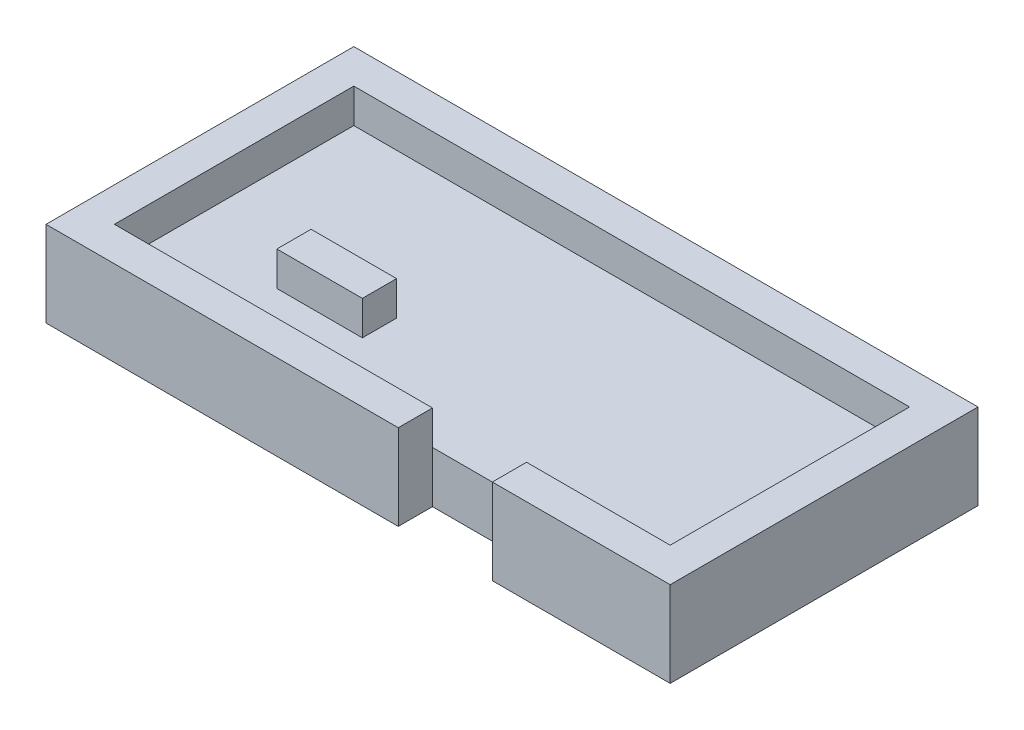
from build123d import *

# Parameters (mm, degrees)
SKETCH1_W           = 36.5
SKETCH1_H           = 18
BOSS_EXTRUDE1_DEPTH = 5
SKETCH2_W           = 32.5
SKETCH2_H           = 14
CUT_EXTRUDE1_DEPTH  = 2
SKETCH3_W           = 5
SKETCH3_H           = 2
BOSS_EXTRUDE2_DEPTH = 2
CUT_EXTRUDE2_REACH  = 42.165
SKETCH4_W           = 5.5
SKETCH4_H           = 5


with BuildPart() as part:
    # Sketch1 → Boss-Extrude1 (new body)
    with BuildSketch(Plane(origin=(0, 0, 0), x_dir=(1, 0, 0), z_dir=(0, 1, 0))):
        with Locations((18.25, 9)):
            Rectangle(SKETCH1_W, SKETCH1_H)
    extrude(amount=-BOSS_EXTRUDE1_DEPTH)

    # Sketch2 → Cut-Extrude1 (cut)
    with BuildSketch(Plane(origin=(0, 0, 0), x_dir=(1, 0, 0), z_dir=(0, 1, 0))):
        with Locations((18.25, 9)):
            Rectangle(SKETCH2_W, SKETCH2_H)
    extrude(amount=-CUT_EXTRUDE1_DEPTH, mode=Mode.SUBTRACT)

    # Sketch3 → Boss-Extrude2 (add)
    with BuildSketch(Plane(origin=(0, -2, 0), x_dir=(1, 0, 0), z_dir=(0, 1, 0))):
        with Locations((10.5, 6.5)):
            Rectangle(SKETCH3_W, SKETCH3_H)
    extrude(amount=BOSS_EXTRUDE2_DEPTH)

    # Sketch4 → Cut-Extrude2 (cut, up to next)
    with BuildSketch(Plane(origin=(0, 0, -2), x_dir=(-1, 0, 0), z_dir=(0, 0, -1)), mode=Mode.PRIVATE) as cut_extrude2_sk1:
        with Locations((-23.35, -2.5)):
            Rectangle(SKETCH4_W, SKETCH4_H)
    cut_extrude2_tool1 = extrude(cut_extrude2_sk1.sketch, amount=-CUT_EXTRUDE2_REACH, mode=Mode.PRIVATE) & part.part
    add(cut_extrude2_tool1.solids().sort_by_distance((23.35, -2.5, -2))[0], mode=Mode.SUBTRACT)


solid = part.part
